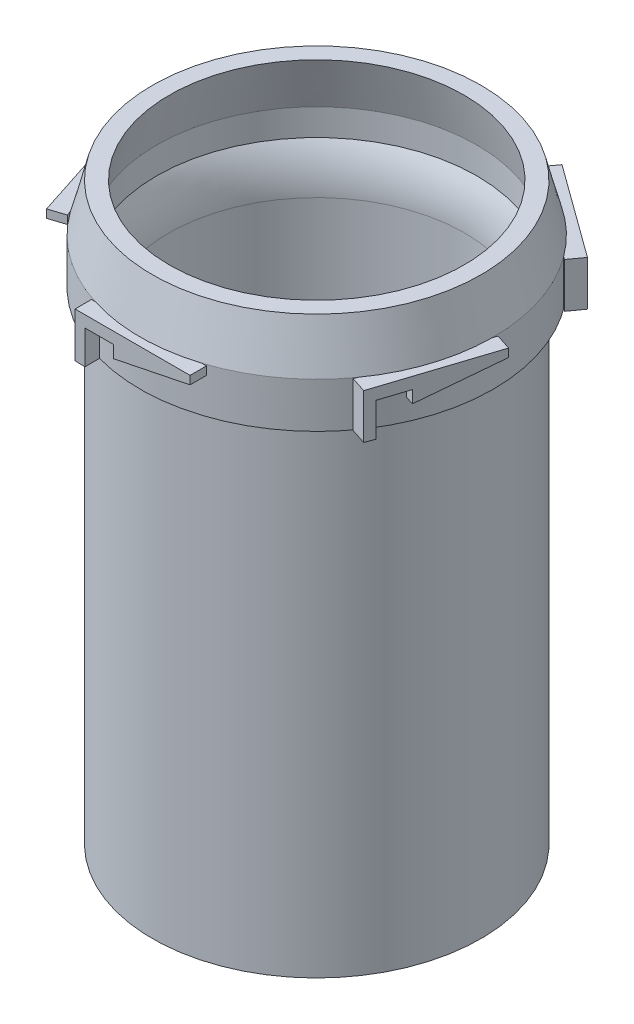
from build123d import *

# Parameters (mm, degrees)
SHELL5_T            = -2
FILLET1_R           = 10
BOSS_EXTRUDE1_DEPTH = 1
CIRPATTERN1_COUNT   = 5


with BuildPart() as part:
    # Sketch1 → Revolve1 (revolve)
    with BuildSketch(Plane.XY, mode=Mode.PRIVATE) as revolve1_sk:
        Polygon((20, 0), (20, 58.690524981), (21.5, 58.690524981), (21.5, 64.190524981), (20, 70), (0, 70), (0, 2.938550041), (5, 2.938550041), (5, 1.5), (19, 1.5), (19, 0), align=None)
    revolve(revolve1_sk.sketch.rotate(Axis((0, 0, 0), (0, 1, 0)), 90), axis=Axis((0, 0, 0), (0, 1, 0)))

    # Shell5
    shell5_openings = [part.faces().sort_by_distance(p)[0] for p in [
        (0, 70, 0),
    ]]
    offset(amount=SHELL5_T, openings=shell5_openings, kind=Kind.INTERSECTION)

    # Fillet1
    # the kernel refuses this fillet: 10 mm, written as the material it takes off along each edge
    with BuildSketch(Plane(origin=(0, 60.690524981, 0), x_dir=(0, 0, -1), z_dir=(1, 0, 0))) as fillet1_piece_1:
        with BuildLine():
            CenterArc((28, -5.267826876), FILLET1_R, 148.211669383, 31.788330617)
            Line((19.5, 0), (19.33, 0.105356538))
            ThreePointArc((19.33, 0.105356538), (18.75, 0.2), (18, 0.2))
            Line((18, 0.2), (17.8, 0))
            Line((17.8, 0), (17.8, -5.267826876))
            Line((17.8, -5.267826876), (18, -5.267826876))
        make_face()
    revolve(axis=Axis((0, 60.690524981, 0), (0, 1, 0)), mode=Mode.SUBTRACT)

    # Sketch4 → Boss-Extrude1 (add, symmetric)
    with BuildSketch(Plane.XY.offset(21.5)):
        Polygon((-2.224405673, 61.290524981), (7.075594327, 63.190524981), (7.075594327, 64.190524981), (-6.924405673, 64.190524981), (-6.924405673, 58.723404538), (-5.724405673, 58.690524981), (-5.724405673, 62.790524981), (-2.224405673, 62.790524981), align=None)
    boss_extrude1 = extrude(amount=BOSS_EXTRUDE1_DEPTH, both=True)

    # CirPattern1: Boss-Extrude1 ×5 about axis
    cirpattern1_axis = Axis((0, 0, 0), (0, 1, 0))
    for i in range(1, CIRPATTERN1_COUNT):
        add(boss_extrude1.rotate(cirpattern1_axis, i * 360 / CIRPATTERN1_COUNT))


solid = part.part
